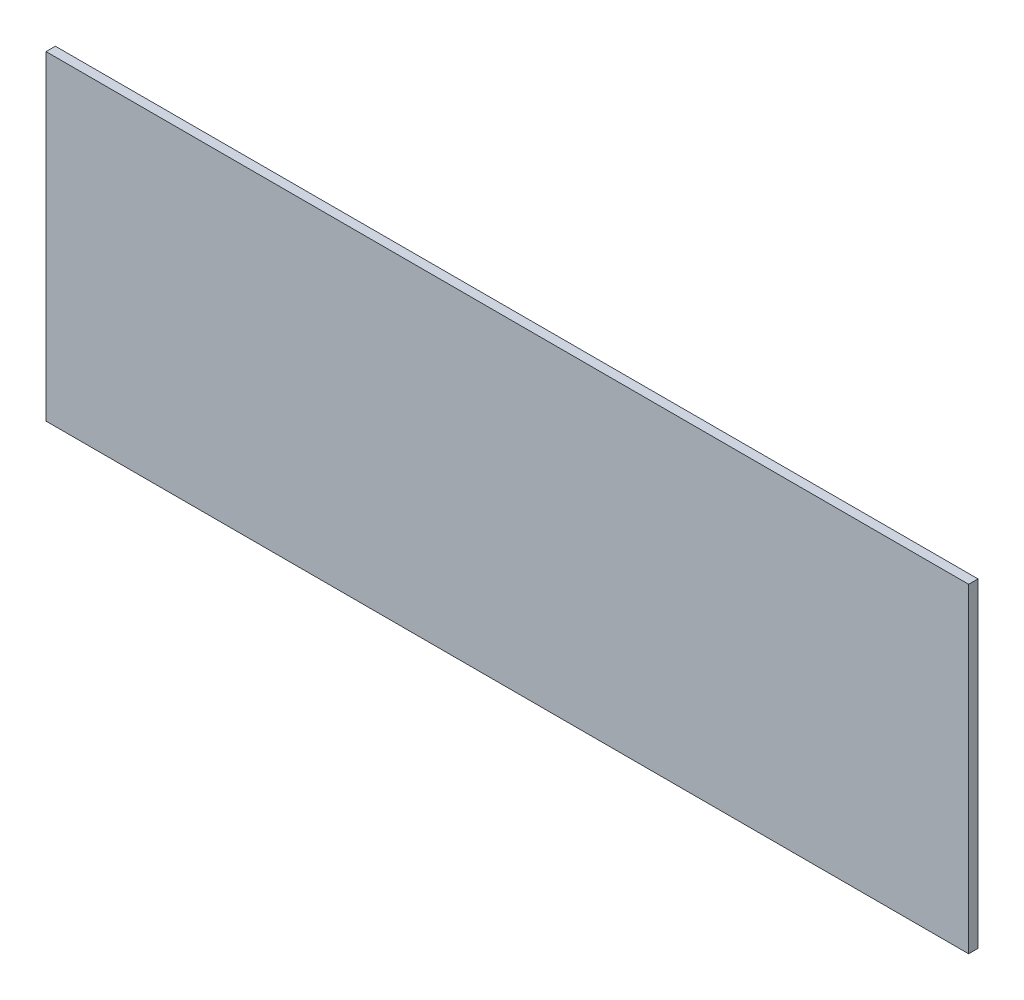
from build123d import *

# Parameters (mm, degrees)
SKETCH1_W           = 234.95
SKETCH1_H           = 81.4959
BOSS_EXTRUDE1_DEPTH = 2.38125


with BuildPart() as part:
    # Sketch1 → Boss-Extrude1 (new body)
    with BuildSketch(Plane.XY):
        Rectangle(SKETCH1_W, SKETCH1_H)
    extrude(amount=BOSS_EXTRUDE1_DEPTH)


solid = part.part
